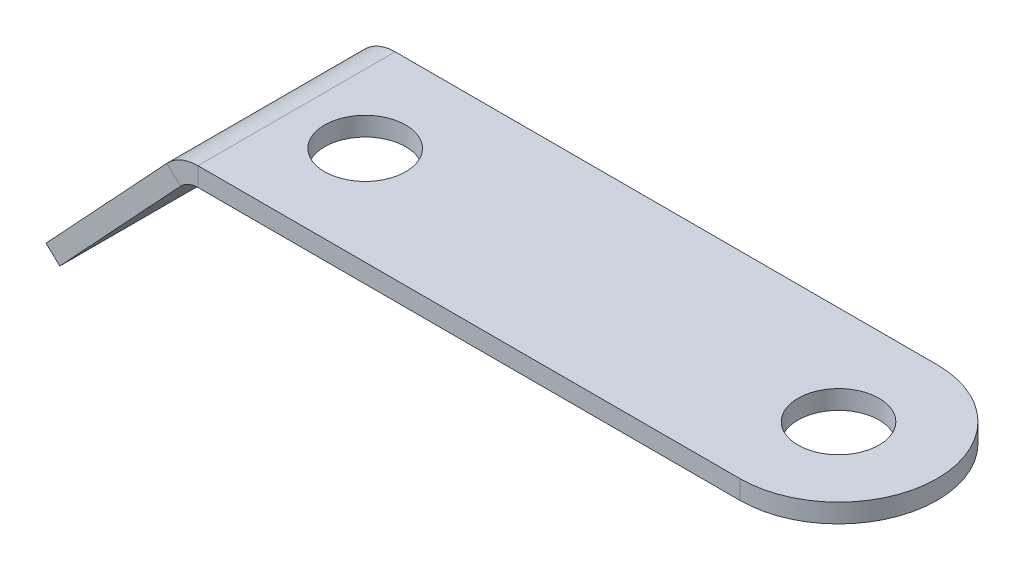
from build123d import *

# Parameters (mm, degrees)
SKETCH1_R                    = 3.2639
BASE_FLANGE1_DEPTH           = 1.51892
EDGE_FLANGE1_STRIP_CUT_DEPTH = 15.875
EDGE_FLANGE1_DEPTH           = 15.875


# Sheet-metal steps are written as plain solids
with BuildPart() as part:
    # Sketch1 → Base-Flange1 (new body)
    with BuildSketch(Plane(origin=(0, 0, 0), x_dir=(1, 0, 0), z_dir=(0, 1, 0))):
        with BuildLine():
            Line((0, 0), (44.45, 0))
            ThreePointArc((44.45, 0), (52.3875, 7.9375), (44.45, 15.875))
            Line((44.45, 15.875), (0, 15.875))
            Line((0, 15.875), (0, 0))
        make_face()
        with Locations(Location((44.45, 7.9375, 0), (0, 0, 270))):
            Circle(SKETCH1_R, mode=Mode.SUBTRACT)
        with Locations(Location((6.35, 7.9375, 0), (0, 0, 270))):
            Circle(SKETCH1_R, mode=Mode.SUBTRACT)
    extrude(amount=-BASE_FLANGE1_DEPTH)

    # Edge-Flange1 strip (across the edge) → Edge-Flange1 strip cut (cut)
    with BuildSketch(Plane(origin=(0, -1.51892, 0), x_dir=(0.7313537016191672, -0.6819983600625019, 0), z_dir=(0, 0, -1))):
        Polygon((-7.660036486, 5.066238556), (-0.430107825, -1.675778992), (0.605793124, -0.564911227), (-6.624135537, 6.177106321), align=None)
    extrude(amount=EDGE_FLANGE1_STRIP_CUT_DEPTH, mode=Mode.SUBTRACT)

    # Edge-Flange1 section (across the edge) → Edge-Flange1 (add)
    with BuildSketch(Plane(origin=(0, -1.51892, 0), x_dir=(0.7313537016191672, -0.6819983600625019, 0), z_dir=(0, 0, -1))):
        with BuildLine():
            Line((-1.51892, 0.828317574), (-1.51892, 15.087554787))
            Line((-1.51892, 15.087554787), (0, 15.087554787))
            Line((0, 15.087554787), (0, 0.828317574))
            ThreePointArc((0, 0.828317574), (0.158000558, 0.068700598), (0.605793124, -0.564911227))
            Line((0.605793124, -0.564911227), (-0.430107825, -1.675778992))
            ThreePointArc((-0.430107825, -1.675778992), (-1.23494033, -0.536967338), (-1.51892, 0.828317574))
        make_face()
    extrude(amount=EDGE_FLANGE1_DEPTH)


solid = part.part
